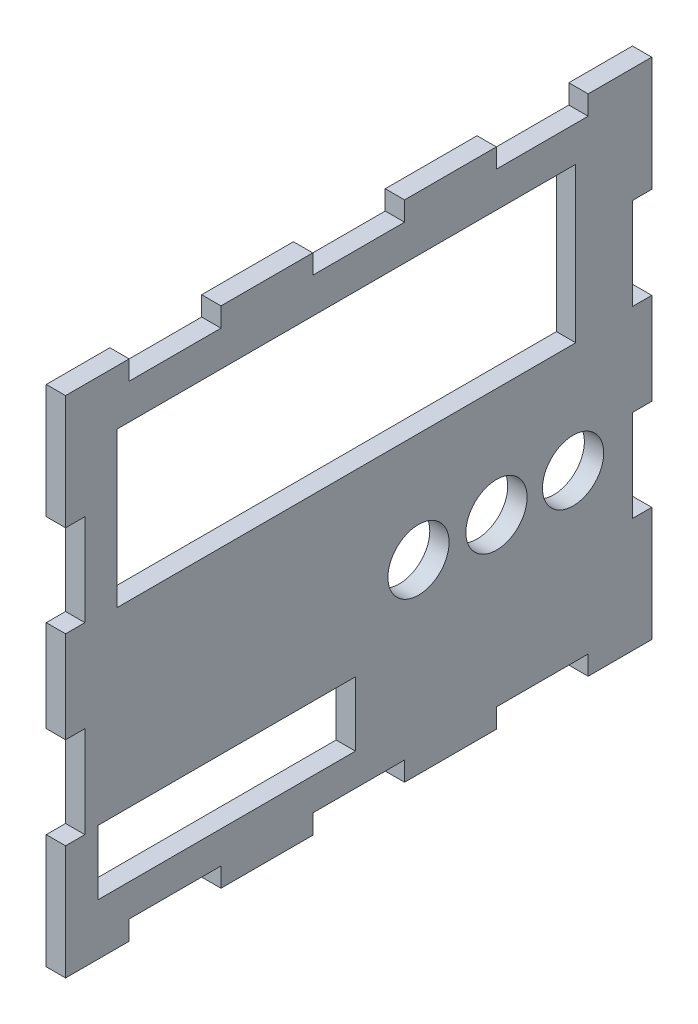
from build123d import *

# Parameters (mm, degrees)
BOSS_EXTRUDE1_DEPTH = 3
SKETCH2_R           = 4.75
SKETCH2_W           = 71.2
SKETCH2_H           = 24
SKETCH2_W_2         = 40
SKETCH2_H_2         = 10
CUT_EXTRUDE1_DEPTH  = 3


with BuildPart() as part:
    # Sketch1 → Boss-Extrude1 (new body)
    with BuildSketch(Plane(origin=(0, 0, 0), x_dir=(0, 0, -1), z_dir=(1, 0, 0))):
        Polygon((-46.800460417, 37.069263333), (-46.800460417, 19.294263333), (-43.800460417, 19.294263333), (-43.800460417, 5.044263333), (-46.800460417, 5.044263333), (-46.800460417, -9.205736667), (-43.800460417, -9.205736667), (-43.800460417, -23.455736667), (-46.800460417, -23.455736667), (-46.800460417, -37.705736667), (-46.800460417, -41.230736667), (-36.925460417, -41.230736667), (-36.925460417, -38.230736667), (-22.675460417, -38.230736667), (-22.675460417, -41.230736667), (-8.425460417, -41.230736667), (-8.425460417, -38.230736667), (5.824539583, -38.230736667), (5.824539583, -41.230736667), (20.074539583, -41.230736667), (20.074539583, -38.230736667), (34.324539583, -38.230736667), (34.324539583, -41.230736667), (44.199539583, -41.230736667), (44.199539583, -23.455736667), (41.199539583, -23.455736667), (41.199539583, -9.205736667), (44.199539583, -9.205736667), (44.199539583, 5.044263333), (41.199539583, 5.044263333), (41.199539583, 19.294263333), (44.199539583, 19.294263333), (44.199539583, 33.544263333), (44.199539583, 37.069263333), (34.324539583, 37.069263333), (34.324539583, 34.069263333), (20.074539583, 34.069263333), (20.074539583, 37.069263333), (5.824539583, 37.069263333), (5.824539583, 34.069263333), (-8.425460417, 34.069263333), (-8.425460417, 37.069263333), (-22.675460417, 37.069263333), (-22.675460417, 34.069263333), (-36.925460417, 34.069263333), (-36.925460417, 37.069263333), align=None)
    extrude(amount=BOSS_EXTRUDE1_DEPTH)

    # Sketch2 → Cut-Extrude1 (cut)
    with BuildSketch(Plane(origin=(3, 0, 0), x_dir=(0, 0, -1), z_dir=(1, 0, 0))):
        with Locations((20.094295928, -12.405736667)):
            Circle(SKETCH2_R)
        with Locations((7.989052272, -12.405736667)):
            Circle(SKETCH2_R)
        with Locations((31.989052272, -12.405736667)):
            Circle(SKETCH2_R)
        with Locations((-3.200460417, 16.569263333)):
            Rectangle(SKETCH2_W, SKETCH2_H)
        with Locations((-21.800460417, -28.230736667)):
            Rectangle(SKETCH2_W_2, SKETCH2_H_2)
    extrude(amount=-CUT_EXTRUDE1_DEPTH, mode=Mode.SUBTRACT)


solid = part.part
